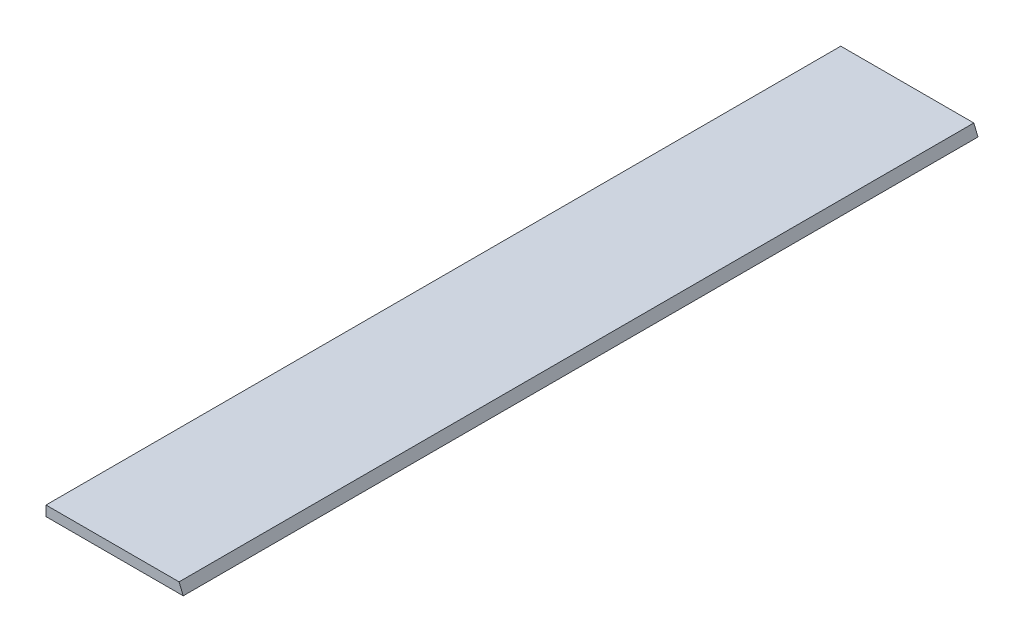
from build123d import *

# Parameters (mm, degrees)
BOSS_EXTRUDE1_DEPTH = 501.65


with BuildPart() as part:
    # Sketch1 → Boss-Extrude1 (new body)
    with BuildSketch(Plane.XY):
        Polygon((0, 0), (0, 6.35), (83.983743879, 6.35), (86.614, 0), align=None)
    extrude(amount=BOSS_EXTRUDE1_DEPTH)


solid = part.part
